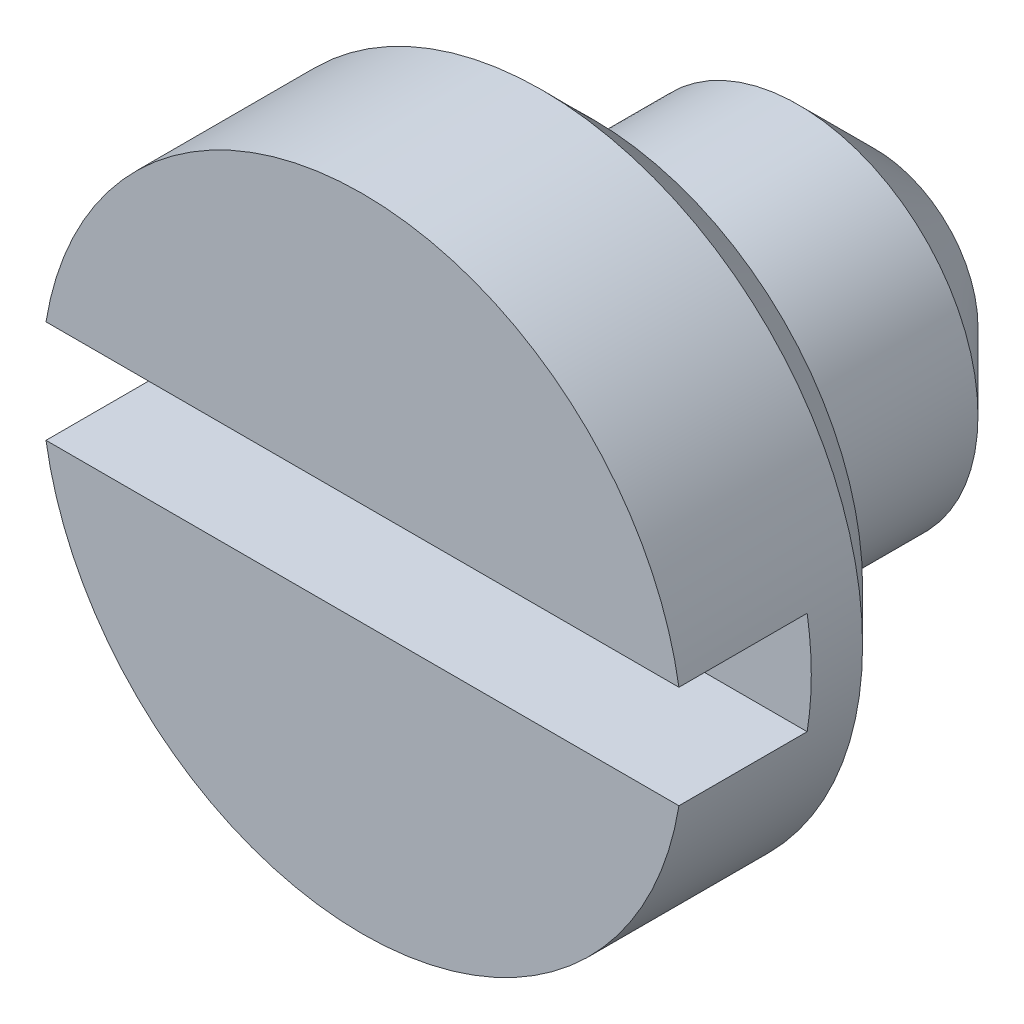
from build123d import *

# Parameters (mm, degrees)
SKETCH1_R           = 1.25
BOSS_EXTRUDE1_DEPTH = 2
SKETCH2_OUTSIDE_W   = 5.312
SKETCH2_OUTSIDE_H   = 5.312
SKETCH2_OUTSIDE_R   = 0.7
CUT_EXTRUDE1_DEPTH  = 1.1
SKETCH3_W           = 2.7
SKETCH3_H           = 0.4
CUT_EXTRUDE2_DEPTH  = 0.5
CHAMFER1_SIZE       = 0.2
CHAMFER2_SIZE       = 0.3


with BuildPart() as part:
    # Sketch1 → Boss-Extrude1 (new body)
    with BuildSketch(Plane.XY):
        Circle(SKETCH1_R)
    extrude(amount=-BOSS_EXTRUDE1_DEPTH)

    # Sketch2 outside → Cut-Extrude1 (cut)
    with BuildSketch(Plane(origin=(0, 0, -2), x_dir=(-1, 0, 0), z_dir=(0, 0, -1))):
        Rectangle(SKETCH2_OUTSIDE_W, SKETCH2_OUTSIDE_H)
        Circle(SKETCH2_OUTSIDE_R, mode=Mode.SUBTRACT)
    extrude(amount=-CUT_EXTRUDE1_DEPTH, mode=Mode.SUBTRACT)

    # Sketch3 → Cut-Extrude2 (cut)
    with BuildSketch(Plane.XY):
        Rectangle(SKETCH3_W, SKETCH3_H)
    extrude(amount=-CUT_EXTRUDE2_DEPTH, mode=Mode.SUBTRACT)

    # Chamfer1
    chamfer1_edges = [part.edges().sort_by_distance(p)[0] for p in [
        (-1.25, 0, -0.9),
    ]]
    chamfer(chamfer1_edges, length=CHAMFER1_SIZE)

    # Chamfer2
    chamfer2_edges = [part.edges().sort_by_distance(p)[0] for p in [
        (0.7, 0, -2),
    ]]
    chamfer(chamfer2_edges, length=CHAMFER2_SIZE)


solid = part.part
